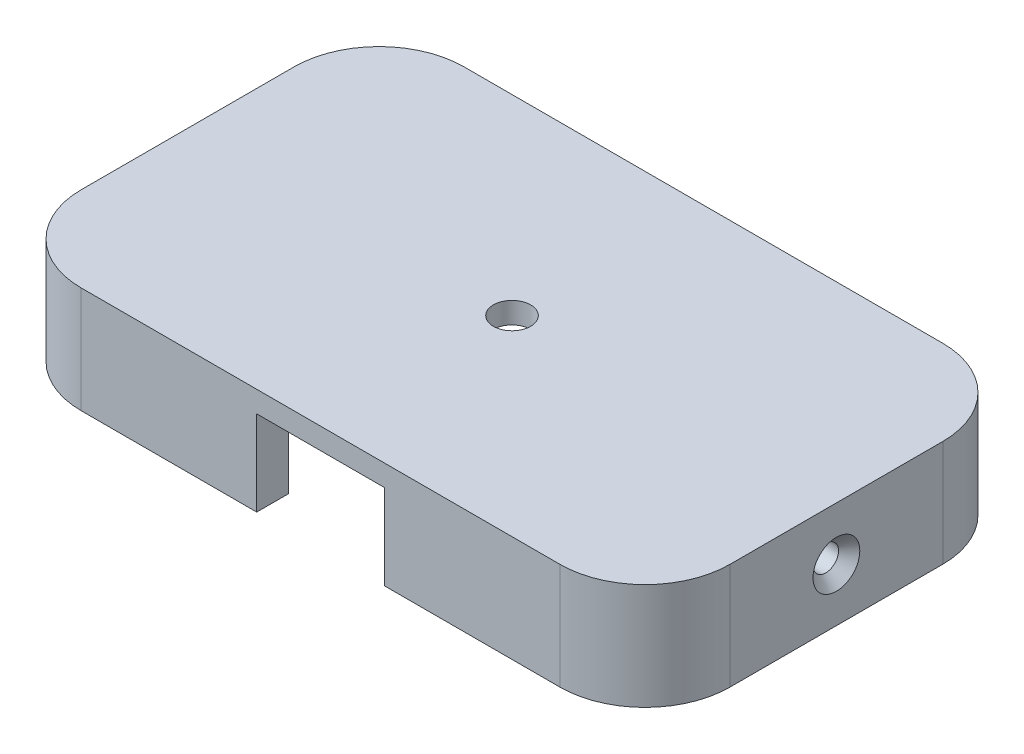
from build123d import *

# Parameters (mm, degrees)
BOSS_EXTRUDE1_DEPTH        = 10
BOSS_EXTRUDE2_DEPTH        = 2
F_3_5_3_5_DIAMETER_HOLE1_D = 3.5
SKETCH8_W                  = 12
SKETCH8_H                  = 8
CUT_EXTRUDE1_DEPTH         = 5


with BuildPart() as part:
    # Sketch1 → Boss-Extrude1 (new body)
    with BuildSketch(Plane(origin=(0, 0, 0), x_dir=(1, 0, 0), z_dir=(0, 1, 0))):
        with BuildLine():
            Line((-22.5, 18), (22.5, 18))
            ThreePointArc((22.5, 18), (28.156854249, 15.656854249), (30.5, 10))
            Line((30.5, 10), (30.5, -10))
            ThreePointArc((30.5, -10), (28.156854249, -15.656854249), (22.5, -18))
            Line((22.5, -18), (-22.5, -18))
            ThreePointArc((-22.5, -18), (-28.156854249, -15.656854249), (-30.5, -10))
            Line((-30.5, -10), (-30.5, 10))
            ThreePointArc((-30.5, 10), (-28.156854249, 15.656854249), (-22.5, 18))
        make_face()
        with BuildLine():
            Line((-22.5, -15), (22.5, -15))
            ThreePointArc((22.5, -15), (26.035533906, -13.535533906), (27.5, -10))
            Line((27.5, -10), (27.5, 10))
            ThreePointArc((27.5, 10), (26.035533906, 13.535533906), (22.5, 15))
            Line((22.5, 15), (-22.5, 15))
            ThreePointArc((-22.5, 15), (-26.035533906, 13.535533906), (-27.5, 10))
            Line((-27.5, 10), (-27.5, -10))
            ThreePointArc((-27.5, -10), (-26.035533906, -13.535533906), (-22.5, -15))
        make_face(mode=Mode.SUBTRACT)
    extrude(amount=-BOSS_EXTRUDE1_DEPTH)

    # Sketch1<2> → Boss-Extrude2 (add)
    with BuildSketch(Plane(origin=(0, 0, 0), x_dir=(1, 0, 0), z_dir=(0, 1, 0))):
        with BuildLine():
            ThreePointArc((-27.5, -10), (-26.035533906, -13.535533906), (-22.5, -15))
            Line((-22.5, -15), (22.5, -15))
            ThreePointArc((22.5, -15), (26.035533906, -13.535533906), (27.5, -10))
            Line((27.5, -10), (27.5, 10))
            ThreePointArc((27.5, 10), (26.035533906, 13.535533906), (22.5, 15))
            Line((22.5, 15), (-22.5, 15))
            ThreePointArc((-22.5, 15), (-26.035533906, 13.535533906), (-27.5, 10))
            Line((-27.5, 10), (-27.5, -10))
        make_face()
    extrude(amount=-BOSS_EXTRUDE2_DEPTH)

    # Sketch4 → CSK for M2 Flat Head Machine Screw1 (revolve, cut)
    with BuildSketch(Plane(origin=(30.5, -5, 0), x_dir=(0, 0, -1), z_dir=(0, 1, 0))):
        Polygon((0, 0), (0, 10.721032743), (1.2, 10), (1.2, 1), (2.2, 0), align=None)
    csk_for_m2_flat_head_machine_screw1 = revolve(axis=Axis((36.85, -5, 0), (-1, 0, 0)), mode=Mode.SUBTRACT)

    # Mirror1: CSK for M2 Flat Head Machine Screw1 across plane
    add(csk_for_m2_flat_head_machine_screw1.mirror(Plane(origin=(0, 0, 0), x_dir=(0, 0, 1), z_dir=(1, 0, 0))), mode=Mode.SUBTRACT)

    # Ø3.5 (3.5) Diameter Hole1 (through all)
    with Locations(Plane(origin=(0, -2, 0), x_dir=(-1, 0, 0), z_dir=(0, -1, 0))):
        with Locations((0, 0)):
            Hole(F_3_5_3_5_DIAMETER_HOLE1_D / 2)

    # Sketch8 → Cut-Extrude1 (cut)
    with BuildSketch(Plane.XY.offset(18)):
        with Locations((0, -6)):
            Rectangle(SKETCH8_W, SKETCH8_H)
    extrude(amount=-CUT_EXTRUDE1_DEPTH, mode=Mode.SUBTRACT)


solid = part.part
